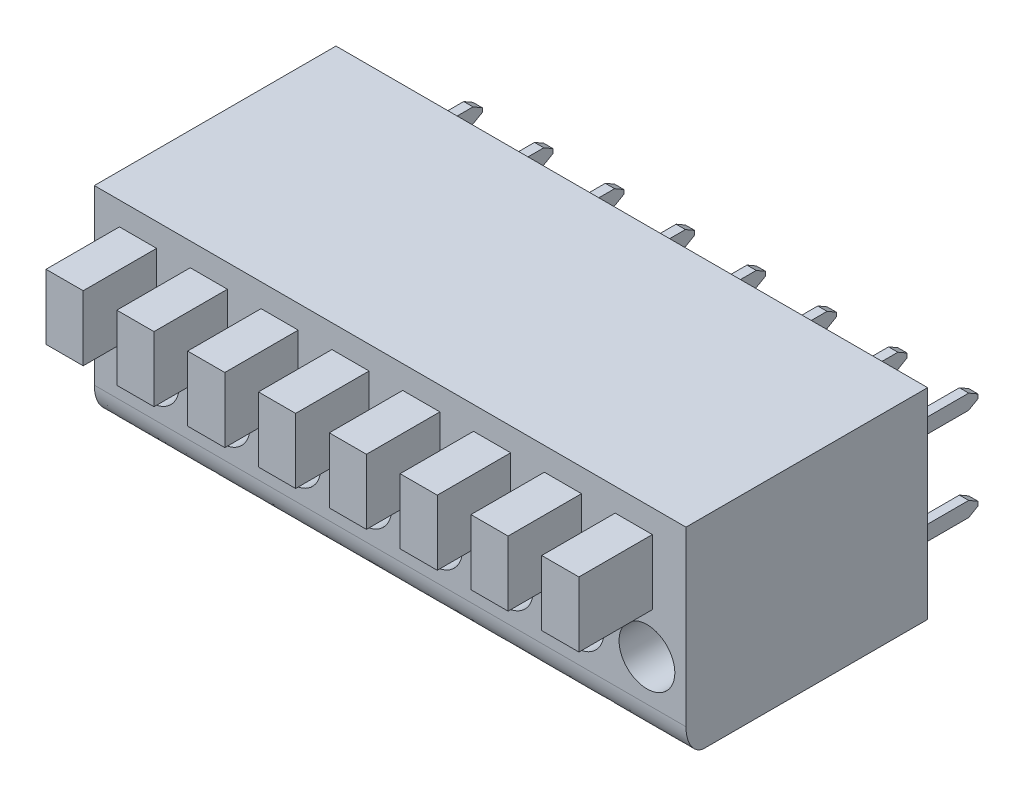
from build123d import *
from OCP.BRepFilletAPI import BRepFilletAPI_MakeChamfer

# Parameters (mm, degrees)
SKETCH_1_W                          = 31.83
SKETCH_1_H                          = 10.8
EXTRUDE_1_DEPTH                     = 13
FILLET_1_SIZE                       = 1
FILLET_1_SIZE_2                     = 1.5
SKETCH_2_W                          = 2
SKETCH_2_H                          = 3.5
EXTRUDE_2_DEPTH                     = 3.95
SKETCH_3_R                          = 1.5
CUT_EXTRUDE_1_DEPTH                 = 3.95
SKETCH_4_W                          = 0.5
SKETCH_4_H                          = 0.8
EXTRUDE_3_DEPTH                     = 3.5
CHAMFER_1_SIZE                      = 0.5
CHAMFER_1_SIZE2                     = 0.288675135
PATTERN_LINEAR_2_COUNT              = 8
PATTERN_LINEAR_2_PITCH              = 3.81
CHAMFER_1_OF_PATTERN_LINEAR_2_SIZE  = 0.5
CHAMFER_1_OF_PATTERN_LINEAR_2_SIZE2 = 0.288675135


with BuildPart() as part:
    # Эскиз1 → Бобышка-Вытянуть1 (new body)
    with BuildSketch(Plane.XY):
        Rectangle(SKETCH_1_W, SKETCH_1_H)
    extrude(amount=EXTRUDE_1_DEPTH)

    # Скругление1
    # an asymmetric fillet: 1.5, 1 mm, written as the material it takes off along each edge
    with BuildSketch(Plane(origin=(-19.665, -5.4, 13), x_dir=(0, 0, -1), z_dir=(1, 0, 0))) as fillet_1_piece_1:
        with BuildLine():
            Bezier((FILLET_1_SIZE, 0), (0, 0), (0, FILLET_1_SIZE_2), weights=[1, 0.707106781, 1])
            Line((0, FILLET_1_SIZE_2), (0, 0))
            Line((0, 0), (FILLET_1_SIZE, 0))
        make_face()
    extrude(amount=39.33, mode=Mode.SUBTRACT)

    # Эскиз2 → Бобышка-Вытянуть2 (add)
    with BuildSketch(Plane.XY.offset(13)):
        with Locations((13.105, 2.4)):
            Rectangle(SKETCH_2_W, SKETCH_2_H)
    extrude_2 = extrude(amount=EXTRUDE_2_DEPTH)

    # Эскиз3 → Вырез-Вытянуть1 (cut)
    with BuildSketch(Plane.XY.offset(13)):
        with Locations((13.815, -1.686021073)):
            Circle(SKETCH_3_R)
    cut_extrude_1 = extrude(amount=-CUT_EXTRUDE_1_DEPTH, mode=Mode.SUBTRACT)

    # Эскиз4 → Бобышка-Вытянуть3 (add)
    with BuildSketch(Plane(origin=(0, 0, 0), x_dir=(-1, 0, 0), z_dir=(0, 0, -1))):
        with Locations((-14.875, 2.85)):
            Rectangle(SKETCH_4_W, SKETCH_4_H)
        with Locations((-14.875, -2.15)):
            Rectangle(SKETCH_4_W, SKETCH_4_H)
    extrude_3 = extrude(amount=EXTRUDE_3_DEPTH)

    # Фаска1: one chamfer whose edges measure the first distance from different faces: ONE call of the kernel's chamfer builder (chamfer() names one face for all edges)
    chamfer_1_edges_1 = [part.edges().sort_by_distance(p)[0] for p in [
        (14.875, 3.25, -3.5),
    ]]
    chamfer_1_side_1 = [part.faces().sort_by_distance(p)[0] for p in [
        (14.875, 3.25, -1.75),
    ]]
    chamfer_1_edges_2 = [part.edges().sort_by_distance(p)[0] for p in [
        (14.875, 2.45, -3.5),
    ]]
    chamfer_1_side_2 = [part.faces().sort_by_distance(p)[0] for p in [
        (14.875, 2.45, -1.75),
    ]]
    chamfer_1_edges_3 = [part.edges().sort_by_distance(p)[0] for p in [
        (14.875, -2.55, -3.5),
    ]]
    chamfer_1_side_3 = [part.faces().sort_by_distance(p)[0] for p in [
        (14.875, -2.55, -1.75),
    ]]
    chamfer_1_edges_4 = [part.edges().sort_by_distance(p)[0] for p in [
        (14.875, -1.75, -3.5),
    ]]
    chamfer_1_side_4 = [part.faces().sort_by_distance(p)[0] for p in [
        (14.875, -1.75, -1.75),
    ]]
    chamfer_1 = BRepFilletAPI_MakeChamfer(part.part.solid().wrapped)
    for e in chamfer_1_edges_1:
        chamfer_1.Add(CHAMFER_1_SIZE, CHAMFER_1_SIZE2, e.wrapped, chamfer_1_side_1[0].wrapped)  # the first distance lies on this face
    for e in chamfer_1_edges_2:
        chamfer_1.Add(CHAMFER_1_SIZE, CHAMFER_1_SIZE2, e.wrapped, chamfer_1_side_2[0].wrapped)  # the first distance lies on this face
    for e in chamfer_1_edges_3:
        chamfer_1.Add(CHAMFER_1_SIZE, CHAMFER_1_SIZE2, e.wrapped, chamfer_1_side_3[0].wrapped)  # the first distance lies on this face
    for e in chamfer_1_edges_4:
        chamfer_1.Add(CHAMFER_1_SIZE, CHAMFER_1_SIZE2, e.wrapped, chamfer_1_side_4[0].wrapped)  # the first distance lies on this face
    add(Compound.cast(chamfer_1.Shape()), mode=Mode.REPLACE)

    # Линейный массив2: Бобышка-Вытянуть2, Вырез-Вытянуть1, Бобышка-Вытянуть3 ×8
    with Locations(*[(-i * PATTERN_LINEAR_2_PITCH, 0, 0) for i in range(1, PATTERN_LINEAR_2_COUNT)]):
        add(extrude_2)
        add(cut_extrude_1, mode=Mode.SUBTRACT)
        add(extrude_3)

    # Фаска1 of Линейный массив2: one chamfer whose edges measure the first distance from different faces: ONE call of the kernel's chamfer builder (chamfer() names one face for all edges)
    chamfer_1_of_pattern_linear_2_edges_1 = [part.edges().sort_by_distance(p)[0] for p in [
        (11.065, 3.25, -3.5),
    ]]
    chamfer_1_of_pattern_linear_2_side_1 = [part.faces().sort_by_distance(p)[0] for p in [
        (11.065, 3.25, -1.75),
    ]]
    chamfer_1_of_pattern_linear_2_edges_2 = [part.edges().sort_by_distance(p)[0] for p in [
        (11.065, 2.45, -3.5),
    ]]
    chamfer_1_of_pattern_linear_2_side_2 = [part.faces().sort_by_distance(p)[0] for p in [
        (11.065, 2.45, -1.75),
    ]]
    chamfer_1_of_pattern_linear_2_edges_3 = [part.edges().sort_by_distance(p)[0] for p in [
        (11.065, -2.55, -3.5),
    ]]
    chamfer_1_of_pattern_linear_2_side_3 = [part.faces().sort_by_distance(p)[0] for p in [
        (11.065, -2.55, -1.75),
    ]]
    chamfer_1_of_pattern_linear_2_edges_4 = [part.edges().sort_by_distance(p)[0] for p in [
        (11.065, -1.75, -3.5),
    ]]
    chamfer_1_of_pattern_linear_2_side_4 = [part.faces().sort_by_distance(p)[0] for p in [
        (11.065, -1.75, -1.75),
    ]]
    chamfer_1_of_pattern_linear_2_edges_5 = [part.edges().sort_by_distance(p)[0] for p in [
        (7.255, 3.25, -3.5),
    ]]
    chamfer_1_of_pattern_linear_2_side_5 = [part.faces().sort_by_distance(p)[0] for p in [
        (7.255, 3.25, -1.75),
    ]]
    chamfer_1_of_pattern_linear_2_edges_6 = [part.edges().sort_by_distance(p)[0] for p in [
        (7.255, 2.45, -3.5),
    ]]
    chamfer_1_of_pattern_linear_2_side_6 = [part.faces().sort_by_distance(p)[0] for p in [
        (7.255, 2.45, -1.75),
    ]]
    chamfer_1_of_pattern_linear_2_edges_7 = [part.edges().sort_by_distance(p)[0] for p in [
        (7.255, -2.55, -3.5),
    ]]
    chamfer_1_of_pattern_linear_2_side_7 = [part.faces().sort_by_distance(p)[0] for p in [
        (7.255, -2.55, -1.75),
    ]]
    chamfer_1_of_pattern_linear_2_edges_8 = [part.edges().sort_by_distance(p)[0] for p in [
        (7.255, -1.75, -3.5),
    ]]
    chamfer_1_of_pattern_linear_2_side_8 = [part.faces().sort_by_distance(p)[0] for p in [
        (7.255, -1.75, -1.75),
    ]]
    chamfer_1_of_pattern_linear_2_edges_9 = [part.edges().sort_by_distance(p)[0] for p in [
        (3.445, 3.25, -3.5),
    ]]
    chamfer_1_of_pattern_linear_2_side_9 = [part.faces().sort_by_distance(p)[0] for p in [
        (3.445, 3.25, -1.75),
    ]]
    chamfer_1_of_pattern_linear_2_edges_10 = [part.edges().sort_by_distance(p)[0] for p in [
        (3.445, 2.45, -3.5),
    ]]
    chamfer_1_of_pattern_linear_2_side_10 = [part.faces().sort_by_distance(p)[0] for p in [
        (3.445, 2.45, -1.75),
    ]]
    chamfer_1_of_pattern_linear_2_edges_11 = [part.edges().sort_by_distance(p)[0] for p in [
        (3.445, -2.55, -3.5),
    ]]
    chamfer_1_of_pattern_linear_2_side_11 = [part.faces().sort_by_distance(p)[0] for p in [
        (3.445, -2.55, -1.75),
    ]]
    chamfer_1_of_pattern_linear_2_edges_12 = [part.edges().sort_by_distance(p)[0] for p in [
        (3.445, -1.75, -3.5),
    ]]
    chamfer_1_of_pattern_linear_2_side_12 = [part.faces().sort_by_distance(p)[0] for p in [
        (3.445, -1.75, -1.75),
    ]]
    chamfer_1_of_pattern_linear_2_edges_13 = [part.edges().sort_by_distance(p)[0] for p in [
        (-0.365, 3.25, -3.5),
    ]]
    chamfer_1_of_pattern_linear_2_side_13 = [part.faces().sort_by_distance(p)[0] for p in [
        (-0.365, 3.25, -1.75),
    ]]
    chamfer_1_of_pattern_linear_2_edges_14 = [part.edges().sort_by_distance(p)[0] for p in [
        (-0.365, 2.45, -3.5),
    ]]
    chamfer_1_of_pattern_linear_2_side_14 = [part.faces().sort_by_distance(p)[0] for p in [
        (-0.365, 2.45, -1.75),
    ]]
    chamfer_1_of_pattern_linear_2_edges_15 = [part.edges().sort_by_distance(p)[0] for p in [
        (-0.365, -2.55, -3.5),
    ]]
    chamfer_1_of_pattern_linear_2_side_15 = [part.faces().sort_by_distance(p)[0] for p in [
        (-0.365, -2.55, -1.75),
    ]]
    chamfer_1_of_pattern_linear_2_edges_16 = [part.edges().sort_by_distance(p)[0] for p in [
        (-0.365, -1.75, -3.5),
    ]]
    chamfer_1_of_pattern_linear_2_side_16 = [part.faces().sort_by_distance(p)[0] for p in [
        (-0.365, -1.75, -1.75),
    ]]
    chamfer_1_of_pattern_linear_2_edges_17 = [part.edges().sort_by_distance(p)[0] for p in [
        (-4.175, 3.25, -3.5),
    ]]
    chamfer_1_of_pattern_linear_2_side_17 = [part.faces().sort_by_distance(p)[0] for p in [
        (-4.175, 3.25, -1.75),
    ]]
    chamfer_1_of_pattern_linear_2_edges_18 = [part.edges().sort_by_distance(p)[0] for p in [
        (-4.175, 2.45, -3.5),
    ]]
    chamfer_1_of_pattern_linear_2_side_18 = [part.faces().sort_by_distance(p)[0] for p in [
        (-4.175, 2.45, -1.75),
    ]]
    chamfer_1_of_pattern_linear_2_edges_19 = [part.edges().sort_by_distance(p)[0] for p in [
        (-4.175, -2.55, -3.5),
    ]]
    chamfer_1_of_pattern_linear_2_side_19 = [part.faces().sort_by_distance(p)[0] for p in [
        (-4.175, -2.55, -1.75),
    ]]
    chamfer_1_of_pattern_linear_2_edges_20 = [part.edges().sort_by_distance(p)[0] for p in [
        (-4.175, -1.75, -3.5),
    ]]
    chamfer_1_of_pattern_linear_2_side_20 = [part.faces().sort_by_distance(p)[0] for p in [
        (-4.175, -1.75, -1.75),
    ]]
    chamfer_1_of_pattern_linear_2_edges_21 = [part.edges().sort_by_distance(p)[0] for p in [
        (-7.985, 3.25, -3.5),
    ]]
    chamfer_1_of_pattern_linear_2_side_21 = [part.faces().sort_by_distance(p)[0] for p in [
        (-7.985, 3.25, -1.75),
    ]]
    chamfer_1_of_pattern_linear_2_edges_22 = [part.edges().sort_by_distance(p)[0] for p in [
        (-7.985, 2.45, -3.5),
    ]]
    chamfer_1_of_pattern_linear_2_side_22 = [part.faces().sort_by_distance(p)[0] for p in [
        (-7.985, 2.45, -1.75),
    ]]
    chamfer_1_of_pattern_linear_2_edges_23 = [part.edges().sort_by_distance(p)[0] for p in [
        (-7.985, -2.55, -3.5),
    ]]
    chamfer_1_of_pattern_linear_2_side_23 = [part.faces().sort_by_distance(p)[0] for p in [
        (-7.985, -2.55, -1.75),
    ]]
    chamfer_1_of_pattern_linear_2_edges_24 = [part.edges().sort_by_distance(p)[0] for p in [
        (-7.985, -1.75, -3.5),
    ]]
    chamfer_1_of_pattern_linear_2_side_24 = [part.faces().sort_by_distance(p)[0] for p in [
        (-7.985, -1.75, -1.75),
    ]]
    chamfer_1_of_pattern_linear_2_edges_25 = [part.edges().sort_by_distance(p)[0] for p in [
        (-11.795, 3.25, -3.5),
    ]]
    chamfer_1_of_pattern_linear_2_side_25 = [part.faces().sort_by_distance(p)[0] for p in [
        (-11.795, 3.25, -1.75),
    ]]
    chamfer_1_of_pattern_linear_2_edges_26 = [part.edges().sort_by_distance(p)[0] for p in [
        (-11.795, 2.45, -3.5),
    ]]
    chamfer_1_of_pattern_linear_2_side_26 = [part.faces().sort_by_distance(p)[0] for p in [
        (-11.795, 2.45, -1.75),
    ]]
    chamfer_1_of_pattern_linear_2_edges_27 = [part.edges().sort_by_distance(p)[0] for p in [
        (-11.795, -2.55, -3.5),
    ]]
    chamfer_1_of_pattern_linear_2_side_27 = [part.faces().sort_by_distance(p)[0] for p in [
        (-11.795, -2.55, -1.75),
    ]]
    chamfer_1_of_pattern_linear_2_edges_28 = [part.edges().sort_by_distance(p)[0] for p in [
        (-11.795, -1.75, -3.5),
    ]]
    chamfer_1_of_pattern_linear_2_side_28 = [part.faces().sort_by_distance(p)[0] for p in [
        (-11.795, -1.75, -1.75),
    ]]
    chamfer_1_of_pattern_linear_2 = BRepFilletAPI_MakeChamfer(part.part.solid().wrapped)
    for e in chamfer_1_of_pattern_linear_2_edges_1:
        chamfer_1_of_pattern_linear_2.Add(CHAMFER_1_OF_PATTERN_LINEAR_2_SIZE, CHAMFER_1_OF_PATTERN_LINEAR_2_SIZE2, e.wrapped, chamfer_1_of_pattern_linear_2_side_1[0].wrapped)  # the first distance lies on this face
    for e in chamfer_1_of_pattern_linear_2_edges_2:
        chamfer_1_of_pattern_linear_2.Add(CHAMFER_1_OF_PATTERN_LINEAR_2_SIZE, CHAMFER_1_OF_PATTERN_LINEAR_2_SIZE2, e.wrapped, chamfer_1_of_pattern_linear_2_side_2[0].wrapped)  # the first distance lies on this face
    for e in chamfer_1_of_pattern_linear_2_edges_3:
        chamfer_1_of_pattern_linear_2.Add(CHAMFER_1_OF_PATTERN_LINEAR_2_SIZE, CHAMFER_1_OF_PATTERN_LINEAR_2_SIZE2, e.wrapped, chamfer_1_of_pattern_linear_2_side_3[0].wrapped)  # the first distance lies on this face
    for e in chamfer_1_of_pattern_linear_2_edges_4:
        chamfer_1_of_pattern_linear_2.Add(CHAMFER_1_OF_PATTERN_LINEAR_2_SIZE, CHAMFER_1_OF_PATTERN_LINEAR_2_SIZE2, e.wrapped, chamfer_1_of_pattern_linear_2_side_4[0].wrapped)  # the first distance lies on this face
    for e in chamfer_1_of_pattern_linear_2_edges_5:
        chamfer_1_of_pattern_linear_2.Add(CHAMFER_1_OF_PATTERN_LINEAR_2_SIZE, CHAMFER_1_OF_PATTERN_LINEAR_2_SIZE2, e.wrapped, chamfer_1_of_pattern_linear_2_side_5[0].wrapped)  # the first distance lies on this face
    for e in chamfer_1_of_pattern_linear_2_edges_6:
        chamfer_1_of_pattern_linear_2.Add(CHAMFER_1_OF_PATTERN_LINEAR_2_SIZE, CHAMFER_1_OF_PATTERN_LINEAR_2_SIZE2, e.wrapped, chamfer_1_of_pattern_linear_2_side_6[0].wrapped)  # the first distance lies on this face
    for e in chamfer_1_of_pattern_linear_2_edges_7:
        chamfer_1_of_pattern_linear_2.Add(CHAMFER_1_OF_PATTERN_LINEAR_2_SIZE, CHAMFER_1_OF_PATTERN_LINEAR_2_SIZE2, e.wrapped, chamfer_1_of_pattern_linear_2_side_7[0].wrapped)  # the first distance lies on this face
    for e in chamfer_1_of_pattern_linear_2_edges_8:
        chamfer_1_of_pattern_linear_2.Add(CHAMFER_1_OF_PATTERN_LINEAR_2_SIZE, CHAMFER_1_OF_PATTERN_LINEAR_2_SIZE2, e.wrapped, chamfer_1_of_pattern_linear_2_side_8[0].wrapped)  # the first distance lies on this face
    for e in chamfer_1_of_pattern_linear_2_edges_9:
        chamfer_1_of_pattern_linear_2.Add(CHAMFER_1_OF_PATTERN_LINEAR_2_SIZE, CHAMFER_1_OF_PATTERN_LINEAR_2_SIZE2, e.wrapped, chamfer_1_of_pattern_linear_2_side_9[0].wrapped)  # the first distance lies on this face
    for e in chamfer_1_of_pattern_linear_2_edges_10:
        chamfer_1_of_pattern_linear_2.Add(CHAMFER_1_OF_PATTERN_LINEAR_2_SIZE, CHAMFER_1_OF_PATTERN_LINEAR_2_SIZE2, e.wrapped, chamfer_1_of_pattern_linear_2_side_10[0].wrapped)  # the first distance lies on this face
    for e in chamfer_1_of_pattern_linear_2_edges_11:
        chamfer_1_of_pattern_linear_2.Add(CHAMFER_1_OF_PATTERN_LINEAR_2_SIZE, CHAMFER_1_OF_PATTERN_LINEAR_2_SIZE2, e.wrapped, chamfer_1_of_pattern_linear_2_side_11[0].wrapped)  # the first distance lies on this face
    for e in chamfer_1_of_pattern_linear_2_edges_12:
        chamfer_1_of_pattern_linear_2.Add(CHAMFER_1_OF_PATTERN_LINEAR_2_SIZE, CHAMFER_1_OF_PATTERN_LINEAR_2_SIZE2, e.wrapped, chamfer_1_of_pattern_linear_2_side_12[0].wrapped)  # the first distance lies on this face
    for e in chamfer_1_of_pattern_linear_2_edges_13:
        chamfer_1_of_pattern_linear_2.Add(CHAMFER_1_OF_PATTERN_LINEAR_2_SIZE, CHAMFER_1_OF_PATTERN_LINEAR_2_SIZE2, e.wrapped, chamfer_1_of_pattern_linear_2_side_13[0].wrapped)  # the first distance lies on this face
    for e in chamfer_1_of_pattern_linear_2_edges_14:
        chamfer_1_of_pattern_linear_2.Add(CHAMFER_1_OF_PATTERN_LINEAR_2_SIZE, CHAMFER_1_OF_PATTERN_LINEAR_2_SIZE2, e.wrapped, chamfer_1_of_pattern_linear_2_side_14[0].wrapped)  # the first distance lies on this face
    for e in chamfer_1_of_pattern_linear_2_edges_15:
        chamfer_1_of_pattern_linear_2.Add(CHAMFER_1_OF_PATTERN_LINEAR_2_SIZE, CHAMFER_1_OF_PATTERN_LINEAR_2_SIZE2, e.wrapped, chamfer_1_of_pattern_linear_2_side_15[0].wrapped)  # the first distance lies on this face
    for e in chamfer_1_of_pattern_linear_2_edges_16:
        chamfer_1_of_pattern_linear_2.Add(CHAMFER_1_OF_PATTERN_LINEAR_2_SIZE, CHAMFER_1_OF_PATTERN_LINEAR_2_SIZE2, e.wrapped, chamfer_1_of_pattern_linear_2_side_16[0].wrapped)  # the first distance lies on this face
    for e in chamfer_1_of_pattern_linear_2_edges_17:
        chamfer_1_of_pattern_linear_2.Add(CHAMFER_1_OF_PATTERN_LINEAR_2_SIZE, CHAMFER_1_OF_PATTERN_LINEAR_2_SIZE2, e.wrapped, chamfer_1_of_pattern_linear_2_side_17[0].wrapped)  # the first distance lies on this face
    for e in chamfer_1_of_pattern_linear_2_edges_18:
        chamfer_1_of_pattern_linear_2.Add(CHAMFER_1_OF_PATTERN_LINEAR_2_SIZE, CHAMFER_1_OF_PATTERN_LINEAR_2_SIZE2, e.wrapped, chamfer_1_of_pattern_linear_2_side_18[0].wrapped)  # the first distance lies on this face
    for e in chamfer_1_of_pattern_linear_2_edges_19:
        chamfer_1_of_pattern_linear_2.Add(CHAMFER_1_OF_PATTERN_LINEAR_2_SIZE, CHAMFER_1_OF_PATTERN_LINEAR_2_SIZE2, e.wrapped, chamfer_1_of_pattern_linear_2_side_19[0].wrapped)  # the first distance lies on this face
    for e in chamfer_1_of_pattern_linear_2_edges_20:
        chamfer_1_of_pattern_linear_2.Add(CHAMFER_1_OF_PATTERN_LINEAR_2_SIZE, CHAMFER_1_OF_PATTERN_LINEAR_2_SIZE2, e.wrapped, chamfer_1_of_pattern_linear_2_side_20[0].wrapped)  # the first distance lies on this face
    for e in chamfer_1_of_pattern_linear_2_edges_21:
        chamfer_1_of_pattern_linear_2.Add(CHAMFER_1_OF_PATTERN_LINEAR_2_SIZE, CHAMFER_1_OF_PATTERN_LINEAR_2_SIZE2, e.wrapped, chamfer_1_of_pattern_linear_2_side_21[0].wrapped)  # the first distance lies on this face
    for e in chamfer_1_of_pattern_linear_2_edges_22:
        chamfer_1_of_pattern_linear_2.Add(CHAMFER_1_OF_PATTERN_LINEAR_2_SIZE, CHAMFER_1_OF_PATTERN_LINEAR_2_SIZE2, e.wrapped, chamfer_1_of_pattern_linear_2_side_22[0].wrapped)  # the first distance lies on this face
    for e in chamfer_1_of_pattern_linear_2_edges_23:
        chamfer_1_of_pattern_linear_2.Add(CHAMFER_1_OF_PATTERN_LINEAR_2_SIZE, CHAMFER_1_OF_PATTERN_LINEAR_2_SIZE2, e.wrapped, chamfer_1_of_pattern_linear_2_side_23[0].wrapped)  # the first distance lies on this face
    for e in chamfer_1_of_pattern_linear_2_edges_24:
        chamfer_1_of_pattern_linear_2.Add(CHAMFER_1_OF_PATTERN_LINEAR_2_SIZE, CHAMFER_1_OF_PATTERN_LINEAR_2_SIZE2, e.wrapped, chamfer_1_of_pattern_linear_2_side_24[0].wrapped)  # the first distance lies on this face
    for e in chamfer_1_of_pattern_linear_2_edges_25:
        chamfer_1_of_pattern_linear_2.Add(CHAMFER_1_OF_PATTERN_LINEAR_2_SIZE, CHAMFER_1_OF_PATTERN_LINEAR_2_SIZE2, e.wrapped, chamfer_1_of_pattern_linear_2_side_25[0].wrapped)  # the first distance lies on this face
    for e in chamfer_1_of_pattern_linear_2_edges_26:
        chamfer_1_of_pattern_linear_2.Add(CHAMFER_1_OF_PATTERN_LINEAR_2_SIZE, CHAMFER_1_OF_PATTERN_LINEAR_2_SIZE2, e.wrapped, chamfer_1_of_pattern_linear_2_side_26[0].wrapped)  # the first distance lies on this face
    for e in chamfer_1_of_pattern_linear_2_edges_27:
        chamfer_1_of_pattern_linear_2.Add(CHAMFER_1_OF_PATTERN_LINEAR_2_SIZE, CHAMFER_1_OF_PATTERN_LINEAR_2_SIZE2, e.wrapped, chamfer_1_of_pattern_linear_2_side_27[0].wrapped)  # the first distance lies on this face
    for e in chamfer_1_of_pattern_linear_2_edges_28:
        chamfer_1_of_pattern_linear_2.Add(CHAMFER_1_OF_PATTERN_LINEAR_2_SIZE, CHAMFER_1_OF_PATTERN_LINEAR_2_SIZE2, e.wrapped, chamfer_1_of_pattern_linear_2_side_28[0].wrapped)  # the first distance lies on this face
    add(Compound.cast(chamfer_1_of_pattern_linear_2.Shape()), mode=Mode.REPLACE)


solid = part.part
